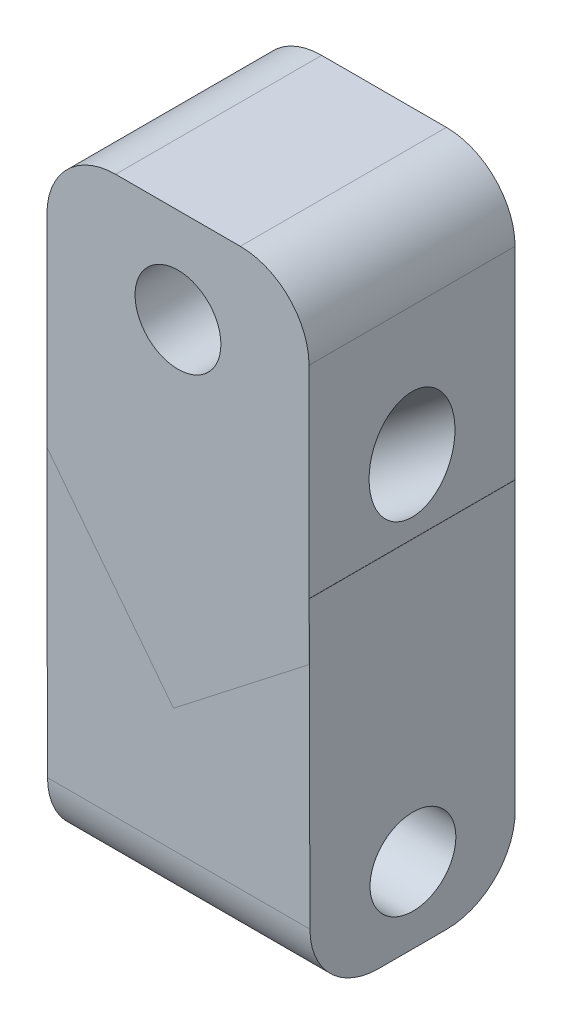
from build123d import *

# Parameters (mm, degrees)
SKETCH5_W           = 60
SKETCH5_H           = 60
SKETCH5_R           = 12.5
BOSS_EXTRUDE3_DEPTH = 25
SKETCH9_R           = 12.5
BOSS_EXTRUDE5_DEPTH = 30
SKETCH10_R          = 12.5
BOSS_EXTRUDE6_DEPTH = 38.21
SKETCH5_2_R         = 12.5
CUT_EXTRUDE2_DEPTH  = 115


with BuildPart() as part:
    # Sketch5 → Boss-Extrude3 (new, symmetric)
    with BuildSketch(Plane(origin=(0, 0, 0), x_dir=(0, 0, -1), z_dir=(0.7890840848346939, 0.6142852000989389, 0))):
        Rectangle(SKETCH5_W, SKETCH5_H)
        Circle(SKETCH5_R, mode=Mode.SUBTRACT)
    extrude(amount=BOSS_EXTRUDE3_DEPTH, both=True)

    # Sketch9 → Boss-Extrude5 (add, symmetric)
    with BuildSketch(Plane.XY):
        with BuildLine():
            Line((38.155658124, -8.315392543), (38.155658124, 67.179146139))
            ThreePointArc((38.155658124, 67.179146139), (32.297793748, 81.321281763), (18.155658124, 87.179146139))
            Line((18.155658124, 87.179146139), (-18.155658124, 87.179146139))
            ThreePointArc((-18.155658124, 87.179146139), (-32.297793748, 81.321281763), (-38.155658124, 67.179146139))
            Line((-38.155658124, 67.179146139), (-38.155658124, 8.315392543))
            Line((-38.155658124, 8.315392543), (38.155658124, -8.315392543))
        make_face()
        with Locations((0, 59.597275262)):
            Circle(SKETCH9_R, mode=Mode.SUBTRACT)
    extrude(amount=BOSS_EXTRUDE5_DEPTH, both=True)

    # Sketch10 → Boss-Extrude6 (add, symmetric)
    with BuildSketch(Plane(origin=(0, 0, 0), x_dir=(0, 0, -1), z_dir=(1, 0, 0))):
        with BuildLine():
            Line((-9.782535048, -95.063583891), (10, -95.063583891))
            ThreePointArc((10, -95.063583891), (24.142135624, -89.205719514), (30, -75.063583891))
            Line((30, -75.063583891), (30, 8.315392543))
            Line((30, 8.315392543), (-30, 8.315392543))
            Line((-30, 8.315392543), (-29.782467066, -75.115730425))
            ThreePointArc((-29.782467066, -75.115730425), (-23.906222055, -89.224144096), (-9.782535048, -95.063583891))
        make_face()
        with Locations((0.212284272, -73.063583891)):
            Circle(SKETCH10_R, mode=Mode.SUBTRACT)
    extrude(amount=BOSS_EXTRUDE6_DEPTH, both=True)

    # Sketch5<2> → Cut-Extrude2 (cut, symmetric)
    with BuildSketch(Plane(origin=(0, 0, 0), x_dir=(0, 0, -1), z_dir=(0.7890840848346939, 0.6142852000989389, 0))):
        Circle(SKETCH5_2_R)
    extrude(amount=CUT_EXTRUDE2_DEPTH, both=True, mode=Mode.SUBTRACT)


solid = part.part
